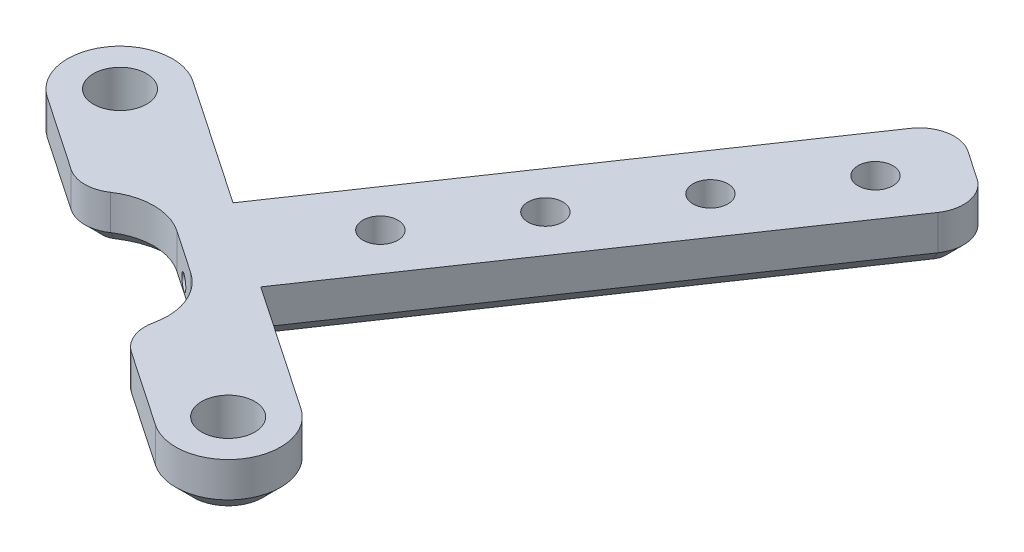
from build123d import *

# Parameters (mm, degrees)
SKETCH14_R                    = 7.6
BOSS_EXTRUDE1_DEPTH           = 15
CUT_EXTRUDE1_DEPTH            = 250.968047238
SKETCH18_R                    = 5.000000002
CUT_EXTRUDE3_DEPTH            = 10
CBORE_FOR_M3_SHCS1_AT_2_COUNT = 2
CBORE_FOR_M3_SHCS1_AT_2_PITCH = 34
CBORE_FOR_M3_SHCS1_AT_3_COUNT = 2
CBORE_FOR_M3_SHCS1_AT_3_PITCH = 68
CBORE_FOR_M3_SHCS1_AT_4_COUNT = 2
CBORE_FOR_M3_SHCS1_AT_4_PITCH = 102
FILLET2_R                     = 10
SKETCH27_R                    = 2.15
CUT_EXTRUDE7_DEPTH            = 31
FILLET4_R                     = 10
CHAMFER2_SIZE                 = 5


with BuildPart() as part:
    # Sketch14 → Boss-Extrude1 (new body)
    with BuildSketch(Plane(origin=(0, 0, 0), x_dir=(1, 0, 0), z_dir=(0, 1, 0))):
        with BuildLine():
            Line((145.578659545, 185.778692811), (120.770309615, 202.647177442))
            Line((120.770309615, 202.647177442), (36.70902787, 79.01890029))
            Line((36.70902787, 79.01890029), (0.736920471, 103.478203005))
            ThreePointArc((0.736920471, 103.478203005), (-20.101496809, 99.508270356), (-16.13156416, 78.669853075))
            Line((-16.13156416, 78.669853075), (80.621000568, 12.882763014))
            ThreePointArc((80.621000568, 12.882763014), (101.459417848, 16.852695663), (97.489485199, 37.691112944))
            Line((97.489485199, 37.691112944), (61.5173778, 62.150415659))
            Line((61.5173778, 62.150415659), (145.578659545, 185.778692811))
        make_face()
        with Locations((89.055242883, 25.286937979)):
            Circle(SKETCH14_R, mode=Mode.SUBTRACT)
        with Locations((-7.697321844, 91.07402804)):
            Circle(SKETCH14_R, mode=Mode.SUBTRACT)
    extrude(amount=BOSS_EXTRUDE1_DEPTH)

    # Sketch15 → Cut-Extrude1 (cut, through all)
    with BuildSketch(Plane.XZ):
        with BuildLine():
            Line((16.483822764, -35.935364242), (28.887997729, -27.501121927))
            ThreePointArc((28.887997729, -27.501121927), (52.504870647, -32.000378929), (48.005613644, -55.617251847))
            Line((48.005613644, -55.617251847), (35.601438679, -64.051494163))
            ThreePointArc((35.601438679, -64.051494163), (11.984565761, -59.55223716), (16.483822764, -35.935364242))
        make_face()
    extrude(amount=-CUT_EXTRUDE1_DEPTH, mode=Mode.SUBTRACT)

    # Sketch18 → Cut-Extrude3 (cut)
    with BuildSketch(Plane(origin=(0, 15, 0), x_dir=(1, 0, 0), z_dir=(0, 1, 0))):
        with Locations((121.928828159, 177.674035173)):
            Circle(SKETCH18_R)
        with Locations((102.811212244, 149.557905252)):
            Circle(SKETCH18_R)
        with Locations((83.693596328, 121.441775331)):
            Circle(SKETCH18_R)
        with Locations((64.575980413, 93.325645411)):
            Circle(SKETCH18_R)
    extrude(amount=-CUT_EXTRUDE3_DEPTH, mode=Mode.SUBTRACT)

    # Sketch23 → CBORE for M3 SHCS1 (revolve, cut)
    with BuildSketch(Plane(origin=(121.928828159, 0, -177.674035173), x_dir=(0, 0, -1), z_dir=(1, 0, 0))):
        Polygon((0, 0), (0, 16.021463052), (1.7, 15), (1.7, 3), (3.25, 3), (3.25, 0.025), (3.275, 0), align=None)
    cbore_for_m3_shcs1 = revolve(axis=Axis((121.928828159, -6.35, -177.674035173), (0, 1, 0)), mode=Mode.SUBTRACT)

    # CBORE for M3 SHCS1 at 2: CBORE for M3 SHCS1 ×2
    with Locations(*[Vector(-0.5622828210355373, 0, 0.8269449976681146) * (i * CBORE_FOR_M3_SHCS1_AT_2_PITCH) for i in range(1, CBORE_FOR_M3_SHCS1_AT_2_COUNT)]):
        add(cbore_for_m3_shcs1, mode=Mode.SUBTRACT)

    # CBORE for M3 SHCS1 at 3: CBORE for M3 SHCS1 ×2
    with Locations(*[Vector(-0.5622828210355376, 0, 0.8269449976681144) * (i * CBORE_FOR_M3_SHCS1_AT_3_PITCH) for i in range(1, CBORE_FOR_M3_SHCS1_AT_3_COUNT)]):
        add(cbore_for_m3_shcs1, mode=Mode.SUBTRACT)

    # CBORE for M3 SHCS1 at 4: CBORE for M3 SHCS1 ×2
    with Locations(*[Vector(-0.5622828210355375, 0, 0.8269449976681144) * (i * CBORE_FOR_M3_SHCS1_AT_4_PITCH) for i in range(1, CBORE_FOR_M3_SHCS1_AT_4_COUNT)]):
        add(cbore_for_m3_shcs1, mode=Mode.SUBTRACT)

    # Fillet2
    fillet2_edges = [part.edges().sort_by_distance(p)[0] for p in [
        (11.984565761, 7.5, -59.55223716),
        (52.504870647, 7.5, -32.000378929),
    ]]
    fillet(fillet2_edges, radius=FILLET2_R)

    # Sketch27 → Cut-Extrude7 (cut)
    with BuildSketch(Plane(origin=(41.038290449, 0, -60.35469648), x_dir=(0.8269449976681198, 0, 0.5622828210355296), z_dir=(-0.5622828210355296, 0, 0.8269449976681199))):
        with Locations((0.925376796, 7.5)):
            Circle(SKETCH27_R)
    extrude(amount=-CUT_EXTRUDE7_DEPTH, mode=Mode.SUBTRACT)

    # Fillet4
    fillet4_edges = [part.edges().sort_by_distance(p)[0] for p in [
        (145.578659545, 7.5, -185.778692811),
        (120.770309615, 7.5, -202.647177442),
    ]]
    fillet(fillet4_edges, radius=FILLET4_R)

    # Chamfer2
    chamfer2_edges = [part.edges().sort_by_distance(p)[0] for p in [
        (79.503431499, 0, -49.920764302),
        (101.459417848, 0, -16.852695663),
        (69.903740642, 0, -20.169984246),
        (55.515108686, 0, -32.036419435),
        (54.246946096, 0, -47.832588121),
        (41.803526161, 0, -59.834373005),
        (26.067271521, 0, -66.993411345),
        (100.736604567, 0, -119.829829247),
        (10.911289314, 0, -62.364871093),
        (141.50970547, 0, -185.003515242),
        (-5.414304234, 0, -71.382631843),
        (133.17448458, 0, -194.212935126),
        (-20.101496809, 0, -99.508270356),
        (121.545487183, 0, -198.578223367),
        (18.722974171, 0, -91.248551648),
        (75.928254637, 0, -136.698313878),
    ]]
    chamfer(chamfer2_edges, length=CHAMFER2_SIZE)


solid = part.part
